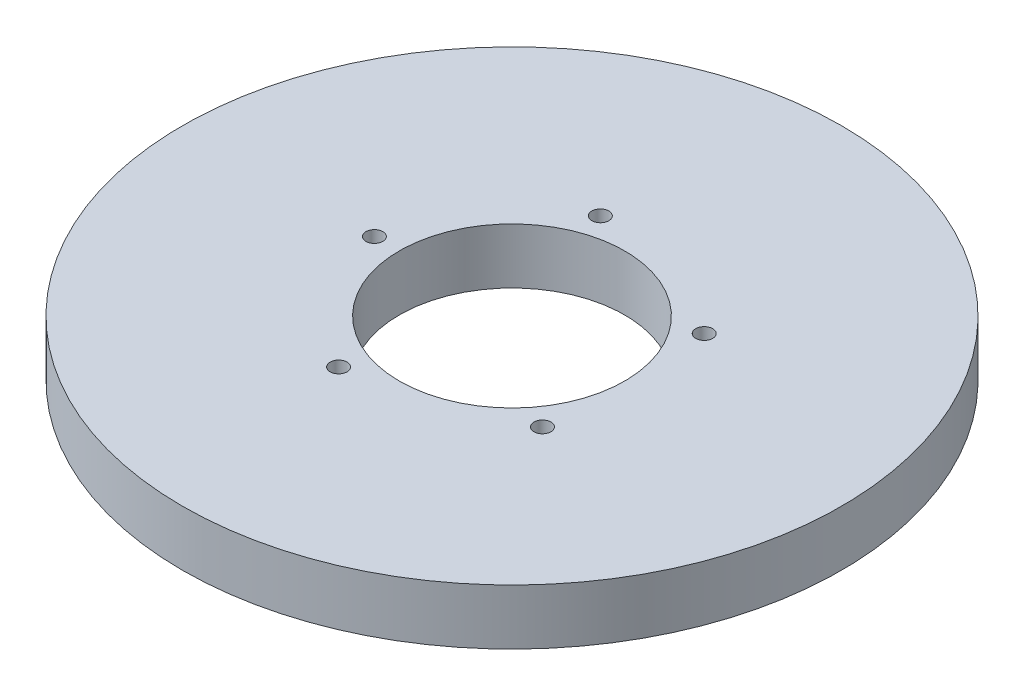
from build123d import *

# Parameters (mm, degrees)
SKETCH1_R           = 95
BOSS_EXTRUDE1_DEPTH = 16
SKETCH2_R           = 32.5
CUT_EXTRUDE1_DEPTH  = 136.299667405
SKETCH3_R           = 2.44474926
CUT_EXTRUDE2_DEPTH  = 10.66272714
CIRPATTERN1_COUNT   = 5


with BuildPart() as part:
    # Sketch1 → Boss-Extrude1 (new body)
    with BuildSketch(Plane(origin=(0, 0, 0), x_dir=(1, 0, 0), z_dir=(0, 1, 0))):
        Circle(SKETCH1_R)
    extrude(amount=BOSS_EXTRUDE1_DEPTH)

    # Sketch2 → Cut-Extrude1 (cut, through all)
    with BuildSketch(Plane(origin=(0, 0, 0), x_dir=(1, 0, 0), z_dir=(0, 1, 0))):
        Circle(SKETCH2_R)
    extrude(amount=CUT_EXTRUDE1_DEPTH, mode=Mode.SUBTRACT)

    # Sketch3 → Cut-Extrude2 (cut)
    with BuildSketch(Plane(origin=(0, 16, 0), x_dir=(1, 0, 0), z_dir=(0, 1, 0))):
        with Locations((-39.662258367, 0)):
            Circle(SKETCH3_R)
    cut_extrude2 = extrude(amount=-CUT_EXTRUDE2_DEPTH, mode=Mode.SUBTRACT)

    # CirPattern1: Cut-Extrude2 ×5 about axis
    cirpattern1_axis = Axis((0, 0, 0), (0, 1, 0))
    for i in range(1, CIRPATTERN1_COUNT):
        add(cut_extrude2.rotate(cirpattern1_axis, i * 360 / CIRPATTERN1_COUNT), mode=Mode.SUBTRACT)


solid = part.part
